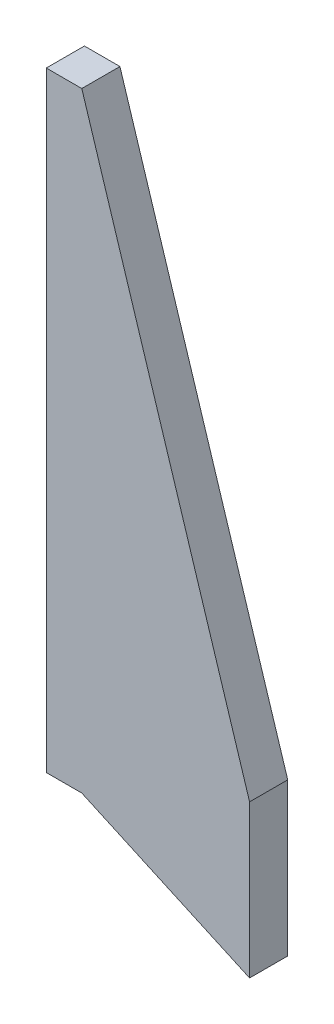
from build123d import *

# Parameters (mm, degrees)
BOSS_EXTRUDE1_DEPTH = 2.5
SKETCH7_W           = 5
SKETCH7_H           = 80
BOSS_EXTRUDE2_DEPTH = 4.655


with BuildPart() as part:
    # Sketch1 → Boss-Extrude1 (new, symmetric)
    with BuildSketch(Plane.XY):
        Polygon((0, 0), (0, 80), (22, 10), (22, -10), align=None)
    extrude(amount=BOSS_EXTRUDE1_DEPTH, both=True)

    # Sketch7 → Boss-Extrude2 (add)
    with BuildSketch(Plane.ZY):
        with Locations((0, 40)):
            Rectangle(SKETCH7_W, SKETCH7_H)
    extrude(amount=BOSS_EXTRUDE2_DEPTH)


solid = part.part
